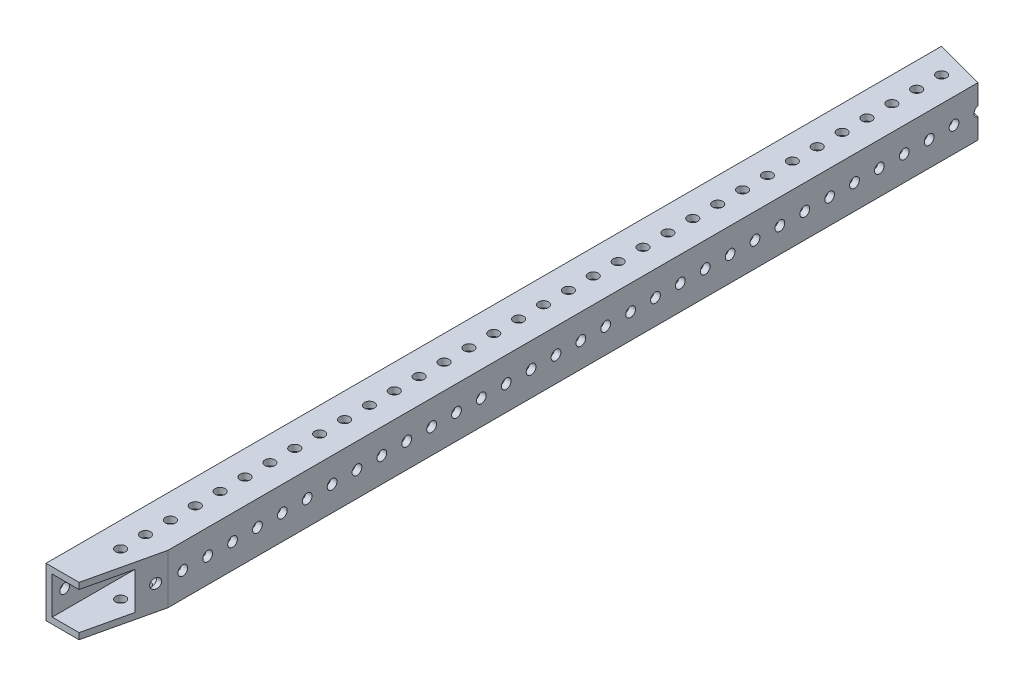
from build123d import *

# Parameters (mm, degrees)
SKETCH1_W           = 25.4
SKETCH1_H           = 25.4
SKETCH1_W_2         = 19.05
SKETCH1_H_2         = 19.05
BOSS_EXTRUDE1_DEPTH = 228.6
SKETCH2_R           = 2.5527
CUT_EXTRUDE1_DEPTH  = 231.35713577
SKETCH4_R           = 2.4892
CUT_EXTRUDE3_DEPTH  = 231.35713577
CUT_EXTRUDE4_DEPTH  = 231.35713577
CUT_EXTRUDE5_DEPTH  = 231.35713577


with BuildPart() as part:
    # Sketch1 → Boss-Extrude1 (new, symmetric)
    with BuildSketch(Plane.XY):
        Rectangle(SKETCH1_W, SKETCH1_H)
        Rectangle(SKETCH1_W_2, SKETCH1_H_2, mode=Mode.SUBTRACT)
    extrude(amount=BOSS_EXTRUDE1_DEPTH, both=True)

    # Sketch2 → Cut-Extrude1 (cut, through all)
    with BuildSketch(Plane(origin=(0, 12.7, 0), x_dir=(1, 0, 0), z_dir=(0, 1, 0))):
        with Locations((0, -266.7)):
            Circle(SKETCH2_R)
        with Locations((0, -254)):
            Circle(SKETCH2_R)
        with Locations((0, -241.3)):
            Circle(SKETCH2_R)
        with Locations((0, -203.2)):
            Circle(SKETCH2_R)
        with Locations((0, -190.5)):
            Circle(SKETCH2_R)
        with Locations((0, -177.8)):
            Circle(SKETCH2_R)
        with Locations((0, -165.1)):
            Circle(SKETCH2_R)
        with Locations((0, -152.4)):
            Circle(SKETCH2_R)
        with Locations((0, -139.7)):
            Circle(SKETCH2_R)
        with Locations((0, -127)):
            Circle(SKETCH2_R)
        with Locations((0, -114.3)):
            Circle(SKETCH2_R)
        with Locations((0, -101.6)):
            Circle(SKETCH2_R)
        with Locations((0, -88.9)):
            Circle(SKETCH2_R)
        with Locations((0, -76.2)):
            Circle(SKETCH2_R)
        with Locations((0, -63.5)):
            Circle(SKETCH2_R)
        with Locations((0, -50.8)):
            Circle(SKETCH2_R)
        with Locations((0, -38.1)):
            Circle(SKETCH2_R)
        with Locations((0, -25.4)):
            Circle(SKETCH2_R)
        with Locations((0, -12.7)):
            Circle(SKETCH2_R)
        Circle(SKETCH2_R)
        with Locations((0, 12.7)):
            Circle(SKETCH2_R)
        with Locations((0, 25.4)):
            Circle(SKETCH2_R)
        with Locations((0, 38.1)):
            Circle(SKETCH2_R)
        with Locations((0, 50.8)):
            Circle(SKETCH2_R)
        with Locations((0, 63.5)):
            Circle(SKETCH2_R)
        with Locations((0, 76.2)):
            Circle(SKETCH2_R)
        with Locations((0, 88.9)):
            Circle(SKETCH2_R)
        with Locations((0, 101.6)):
            Circle(SKETCH2_R)
        with Locations((0, 114.3)):
            Circle(SKETCH2_R)
        with Locations((0, 127)):
            Circle(SKETCH2_R)
        with Locations((0, 139.7)):
            Circle(SKETCH2_R)
        with Locations((0, 152.4)):
            Circle(SKETCH2_R)
        with Locations((0, 165.1)):
            Circle(SKETCH2_R)
        with Locations((0, 177.8)):
            Circle(SKETCH2_R)
        with Locations((0, 190.5)):
            Circle(SKETCH2_R)
        with Locations((0, 203.2)):
            Circle(SKETCH2_R)
        with Locations((0, 215.9)):
            Circle(SKETCH2_R)
        with Locations((0, 228.6)):
            Circle(SKETCH2_R)
        with Locations((0, 241.3)):
            Circle(SKETCH2_R)
        with Locations((0, 254)):
            Circle(SKETCH2_R)
        with Locations((0, 266.7)):
            Circle(SKETCH2_R)
        with Locations((0, 279.4)):
            Circle(SKETCH2_R)
        with Locations((0, 292.1)):
            Circle(SKETCH2_R)
    extrude(amount=-CUT_EXTRUDE1_DEPTH, mode=Mode.SUBTRACT)

    # Sketch4 → Cut-Extrude3 (cut, through all)
    with BuildSketch(Plane(origin=(12.7, 0, 0), x_dir=(0, 0, -1), z_dir=(1, 0, 0))):
        with Locations((-222.25, 0)):
            Circle(SKETCH4_R)
        with Locations((-209.55, 0)):
            Circle(SKETCH4_R)
        with Locations((-196.85, 0)):
            Circle(SKETCH4_R)
        with Locations((-184.15, 0)):
            Circle(SKETCH4_R)
        with Locations((-171.45, 0)):
            Circle(SKETCH4_R)
        with Locations((209.55, 0)):
            Circle(SKETCH4_R)
        with Locations((222.25, 0)):
            Circle(SKETCH4_R)
        with Locations((234.95, 0)):
            Circle(SKETCH4_R)
        with Locations((247.65, 0)):
            Circle(SKETCH4_R)
        with Locations((260.35, 0)):
            Circle(SKETCH4_R)
        with Locations((273.05, 0)):
            Circle(SKETCH4_R)
        with Locations((285.75, 0)):
            Circle(SKETCH4_R)
        with Locations((298.45, 0)):
            Circle(SKETCH4_R)
        with Locations((311.15, 0)):
            Circle(SKETCH4_R)
        with Locations((323.85, 0)):
            Circle(SKETCH4_R)
        with Locations((336.55, 0)):
            Circle(SKETCH4_R)
        with Locations((349.25, 0)):
            Circle(SKETCH4_R)
        with Locations((361.95, 0)):
            Circle(SKETCH4_R)
        with Locations((374.65, 0)):
            Circle(SKETCH4_R)
        with Locations((-158.75, 0)):
            Circle(SKETCH4_R)
        with Locations((-146.05, 0)):
            Circle(SKETCH4_R)
        with Locations((-133.35, 0)):
            Circle(SKETCH4_R)
        with Locations((-120.65, 0)):
            Circle(SKETCH4_R)
        with Locations((-107.95, 0)):
            Circle(SKETCH4_R)
        with Locations((-95.25, 0)):
            Circle(SKETCH4_R)
        with Locations((-82.55, 0)):
            Circle(SKETCH4_R)
        with Locations((-69.85, 0)):
            Circle(SKETCH4_R)
        with Locations((-57.15, 0)):
            Circle(SKETCH4_R)
        with Locations((-44.45, 0)):
            Circle(SKETCH4_R)
        with Locations((-31.75, 0)):
            Circle(SKETCH4_R)
        with Locations((-19.05, 0)):
            Circle(SKETCH4_R)
        with Locations((-6.35, 0)):
            Circle(SKETCH4_R)
        with Locations((6.35, 0)):
            Circle(SKETCH4_R)
        with Locations((19.05, 0)):
            Circle(SKETCH4_R)
        with Locations((31.75, 0)):
            Circle(SKETCH4_R)
        with Locations((44.45, 0)):
            Circle(SKETCH4_R)
        with Locations((57.15, 0)):
            Circle(SKETCH4_R)
        with Locations((69.85, 0)):
            Circle(SKETCH4_R)
        with Locations((82.55, 0)):
            Circle(SKETCH4_R)
        with Locations((95.25, 0)):
            Circle(SKETCH4_R)
        with Locations((107.95, 0)):
            Circle(SKETCH4_R)
        with Locations((120.65, 0)):
            Circle(SKETCH4_R)
        with Locations((133.35, 0)):
            Circle(SKETCH4_R)
        with Locations((146.05, 0)):
            Circle(SKETCH4_R)
        with Locations((158.75, 0)):
            Circle(SKETCH4_R)
        with Locations((171.45, 0)):
            Circle(SKETCH4_R)
        with Locations((184.15, 0)):
            Circle(SKETCH4_R)
        with Locations((196.85, 0)):
            Circle(SKETCH4_R)
    extrude(amount=-CUT_EXTRUDE3_DEPTH, mode=Mode.SUBTRACT)

    # Sketch6 → Cut-Extrude4 (cut, through all)
    with BuildSketch(Plane(origin=(0, 12.7, 0), x_dir=(1, 0, 0), z_dir=(0, 1, 0))):
        Polygon((4.181926551, -228.6), (12.7, -191.704170362), (12.7, -228.6), align=None)
    extrude(amount=-CUT_EXTRUDE4_DEPTH, mode=Mode.SUBTRACT)

    # Sketch7 → Cut-Extrude5 (cut, through all)
    with BuildSketch(Plane(origin=(0, 12.7, 0), x_dir=(1, 0, 0), z_dir=(0, 1, 0))):
        Polygon((-12.7, 228.6), (12.7, 221.794090512), (12.7, 228.6), align=None)
    extrude(amount=-CUT_EXTRUDE5_DEPTH, mode=Mode.SUBTRACT)


solid = part.part
